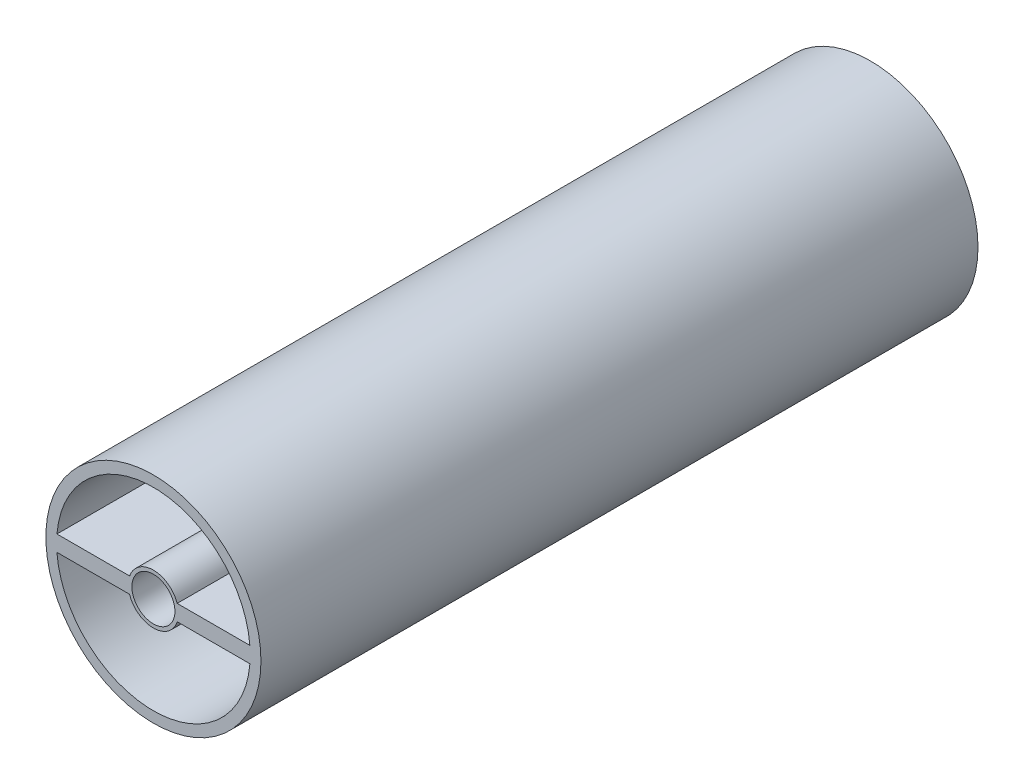
from build123d import *

# Parameters (mm, degrees)
SKETCH2_R           = 15
SKETCH2_R_2         = 3
BOSS_EXTRUDE5_DEPTH = 100


with BuildPart() as part:
    # Sketch2 → Boss-Extrude5 (new body)
    with BuildSketch(Plane.XY):
        Circle(SKETCH2_R)
        with BuildLine():
            ThreePointArc((3.312419342, 1.130432705), (0, 3.5), (-3.312419342, 1.130432705))
            Line((-3.312419342, 1.130432705), (-13.452587926, 1.130432705))
            ThreePointArc((-13.452587926, 1.130432705), (0, 13.5), (13.452587926, 1.130432705))
            Line((13.452587926, 1.130432705), (3.312419342, 1.130432705))
        make_face(mode=Mode.SUBTRACT)
        with BuildLine():
            Line((3.328269001, -1.08287832), (13.456499342, -1.08287832))
            ThreePointArc((13.456499342, -1.08287832), (0, -13.5), (-13.456499342, -1.08287832))
            Line((-13.456499342, -1.08287832), (-3.328269001, -1.08287832))
            ThreePointArc((-3.328269001, -1.08287832), (0, -3.5), (3.328269001, -1.08287832))
        make_face(mode=Mode.SUBTRACT)
        Circle(SKETCH2_R_2, mode=Mode.SUBTRACT)
    extrude(amount=BOSS_EXTRUDE5_DEPTH)


solid = part.part
